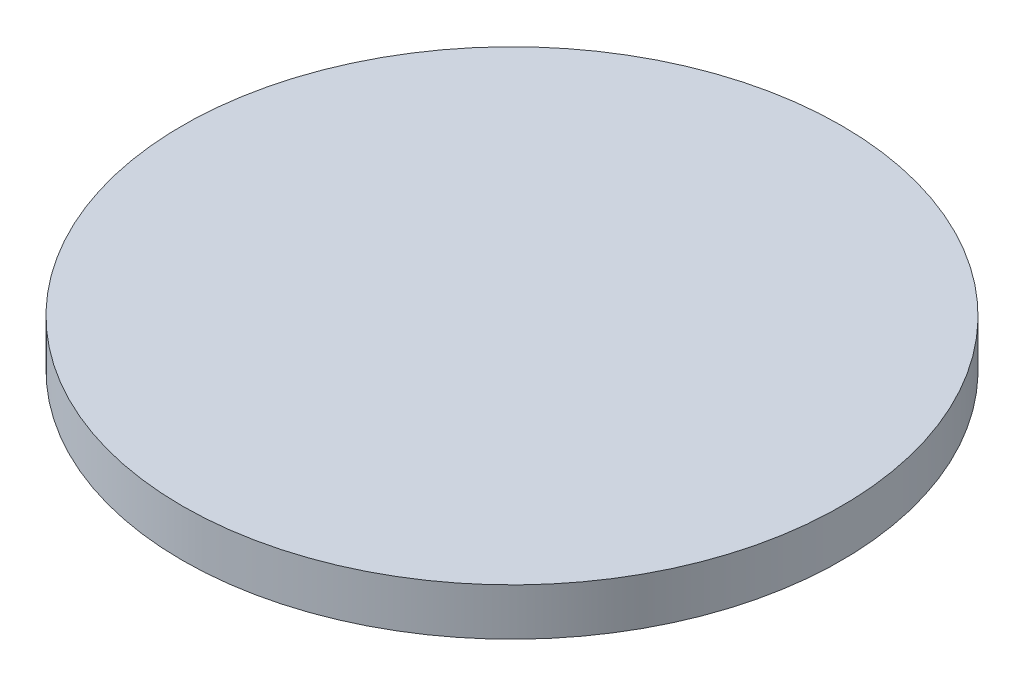
from build123d import *

# Parameters (mm, degrees)
SKETCH1_R           = 70
BOSS_EXTRUDE1_DEPTH = 10
SKETCH2_R           = 65
BOSS_EXTRUDE2_DEPTH = 3


with BuildPart() as part:
    # Sketch1 → Boss-Extrude1 (new body)
    with BuildSketch(Plane(origin=(0, 0, 0), x_dir=(1, 0, 0), z_dir=(0, 1, 0))):
        Circle(SKETCH1_R)
    extrude(amount=BOSS_EXTRUDE1_DEPTH)

    # Sketch2 → Boss-Extrude2 (add)
    with BuildSketch(Plane.XZ):
        Circle(SKETCH2_R)
    extrude(amount=BOSS_EXTRUDE2_DEPTH)


solid = part.part
